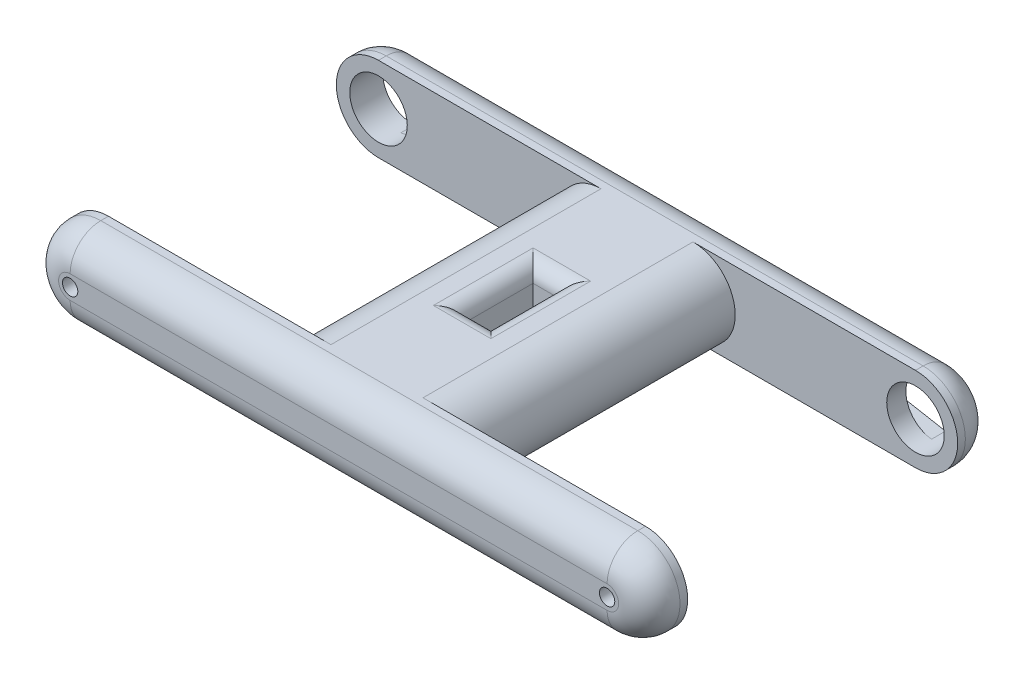
from build123d import *

# Parameters (mm, degrees)
BOSS_EXTRU_1_DEPTH      = 1
BOSS_EXTRU_1_DEPTH_BACK = 4
ESQUISSE1_R             = 3.75
ENL_V_MAT_EXTRU_1_DEPTH = 2.5
BOSS_EXTRU_2_DEPTH      = 35.2
BOSS_EXTRU_3_START      = 5
BOSS_EXTRU_3_DEPTH      = 5
ESQUISSE5_R             = 1
ENL_V_MAT_EXTRU_2_DEPTH = 5
CONG_1_R                = 4
ESQUISSE6_W             = 3.5
ESQUISSE6_H             = 9
ENL_V_MAT_EXTRU_3_DEPTH = 2089.490019804
CONG_2_R                = 2


with BuildPart() as part:
    # Esquisse1 → Boss.-Extru.1 (new, two sides: drawn at the far end of the back side and taken through both)
    with BuildSketch(Plane(origin=(0, 0, 2042.895904074), x_dir=(-1, 0, 0), z_dir=(0, 0, -1)).offset(-BOSS_EXTRU_1_DEPTH_BACK)):
        with BuildLine():
            Line((0, -5.5), (-70, -5.5))
            ThreePointArc((-70, -5.5), (-75.5, 0), (-70, 5.5))
            Line((-70, 5.5), (0, 5.5))
            ThreePointArc((0, 5.5), (5.5, 0), (0, -5.5))
        make_face()
        Circle(ESQUISSE1_R, mode=Mode.SUBTRACT)
        with Locations((-70, 0)):
            Circle(ESQUISSE1_R, mode=Mode.SUBTRACT)
    extrude(amount=BOSS_EXTRU_1_DEPTH + BOSS_EXTRU_1_DEPTH_BACK)

    # Esquisse2 → Enlèv. mat.-Extru.1 (cut)
    with BuildSketch(Plane(origin=(0, 0, 2041.895904074), x_dir=(-1, 0, 0), z_dir=(0, 0, -1))):
        with BuildLine():
            Line((-0.41015625, -3.727502093), (-16.21875, -1.988001116))
            ThreePointArc((-16.21875, -1.988001116), (-18, 0), (-16.21875, 1.988001116))
            Line((-16.21875, 1.988001116), (-0.41015625, 3.727502093))
            Line((-0.41015625, 3.727502093), (-0.41015625, -3.727502093))
        make_face()
        with BuildLine():
            Line((-53.78125, 1.988001116), (-69.58984375, 3.727502093))
            Line((-69.58984375, 3.727502093), (-69.58984375, -3.727502093))
            Line((-69.58984375, -3.727502093), (-53.78125, -1.988001116))
            ThreePointArc((-53.78125, -1.988001116), (-52, 0), (-53.78125, 1.988001116))
        make_face()
    extrude(amount=-ENL_V_MAT_EXTRU_1_DEPTH, mode=Mode.SUBTRACT)

    # Esquisse3 → Boss.-Extru.2 (add)
    with BuildSketch(Plane.XY.offset(2046.895904074)):
        with BuildLine():
            Line((29, 5.5), (41, 5.5))
            ThreePointArc((41, 5.5), (46.5, 0), (41, -5.5))
            Line((41, -5.5), (29, -5.5))
            ThreePointArc((29, -5.5), (23.5, 0), (29, 5.5))
        make_face()
    extrude(amount=BOSS_EXTRU_2_DEPTH)

    # Esquisse4 → Boss.-Extru.3 (add)
    with BuildSketch(Plane.XY.offset(2082.095904074).offset(BOSS_EXTRU_3_START)):
        with BuildLine():
            Line((0, 5.5), (70, 5.5))
            ThreePointArc((70, 5.5), (75.5, 0), (70, -5.5))
            Line((70, -5.5), (0, -5.5))
            ThreePointArc((0, -5.5), (-5.5, 0), (0, 5.5))
        make_face()
    extrude(amount=-BOSS_EXTRU_3_DEPTH)

    # Esquisse5 → Enlèv. mat.-Extru.2 (cut)
    with BuildSketch(Plane.XY.offset(2087.095904074)):
        Circle(ESQUISSE5_R)
        with Locations((70, 0)):
            Circle(ESQUISSE5_R)
    extrude(amount=-ENL_V_MAT_EXTRU_2_DEPTH, mode=Mode.SUBTRACT)

    # Congé1
    # the kernel refuses this fillet: 4 mm, written as the material it takes off along each edge
    with BuildSketch(Plane(origin=(70, 5.5, 2041.895904074), x_dir=(0, 0, 1), z_dir=(-1, 0, 0)), Plane(origin=(0, -5.5, 2041.895904074), x_dir=(0, 0, 1), z_dir=(1, 0, 0)), Plane(origin=(70, -5.5, 2087.095904074), x_dir=(0, 0, -1), z_dir=(-1, 0, 0)), Plane(origin=(0, 5.5, 2087.095904074), x_dir=(0, 0, -1), z_dir=(1, 0, 0))) as cong_1_piece_1:
        with BuildLine():
            CenterArc((CONG_1_R, -CONG_1_R), CONG_1_R, 90, 90)
            Line((0, -CONG_1_R), (0, 0))
            Line((0, 0), (CONG_1_R, 0))
        make_face()
    extrude(amount=70, mode=Mode.SUBTRACT)
    with BuildSketch(Plane(origin=(70, 0, 2087.095904074), x_dir=(0, 1, 0), z_dir=(-1, 0, 0))) as cong_1_piece_2:
        with BuildLine():
            CenterArc((5.5 - CONG_1_R, CONG_1_R), CONG_1_R, 270, 90)
            Line((5.5, CONG_1_R), (5.5, 0))
            Line((5.5, 0), (5.5 - CONG_1_R, 0))
        make_face()
    revolve(axis=Axis((70, 0, 2087.095904074), (0, 0, -1)), revolution_arc=180, mode=Mode.SUBTRACT)
    with BuildSketch(Plane(origin=(0, 0, 2087.095904074), x_dir=(0, -1, 0), z_dir=(1, 0, 0))) as cong_1_piece_3:
        with BuildLine():
            CenterArc((5.5 - CONG_1_R, CONG_1_R), CONG_1_R, 270, 90)
            Line((5.5 - CONG_1_R, 0), (5.5, 0))
            Line((5.5, 0), (5.5, CONG_1_R))
        make_face()
    revolve(axis=Axis((0, 0, 2087.095904074), (0, 0, -1)), revolution_arc=180, mode=Mode.SUBTRACT)
    with BuildSketch(Plane(origin=(0, 0, 2041.895904074), x_dir=(0, 1, 0), z_dir=(1, 0, 0))) as cong_1_piece_4:
        with BuildLine():
            CenterArc((5.5 - CONG_1_R, CONG_1_R), CONG_1_R, 270, 90)
            Line((5.5, CONG_1_R), (5.5, 0))
            Line((5.5, 0), (5.5 - CONG_1_R, 0))
        make_face()
    revolve(axis=Axis((0, 0, 2041.895904074), (0, 0, 1)), revolution_arc=180, mode=Mode.SUBTRACT)
    with BuildSketch(Plane(origin=(70, 0, 2041.895904074), x_dir=(0, -1, 0), z_dir=(-1, 0, 0))) as cong_1_piece_5:
        with BuildLine():
            CenterArc((5.5 - CONG_1_R, CONG_1_R), CONG_1_R, 270, 90)
            Line((5.5 - CONG_1_R, 0), (5.5, 0))
            Line((5.5, 0), (5.5, CONG_1_R))
        make_face()
    revolve(axis=Axis((70, 0, 2041.895904074), (0, 0, 1)), revolution_arc=180, mode=Mode.SUBTRACT)

    # Esquisse6 → Enlèv. mat.-Extru.3 (cut, through all)
    with BuildSketch(Plane(origin=(0, 5.5, 0), x_dir=(1, 0, 0), z_dir=(0, 1, 0))):
        with Locations((35, -2064.495904074)):
            Rectangle(ESQUISSE6_W, ESQUISSE6_H)
    extrude(amount=-ENL_V_MAT_EXTRU_3_DEPTH, mode=Mode.SUBTRACT)

    # Congé2
    cong_2_edges = [part.edges().sort_by_distance(p)[0] for p in [
        (36.75, -5.5, 2064.495904074),
        (35, -5.5, 2068.995904074),
        (33.25, -5.5, 2064.495904074),
        (35, -5.5, 2059.995904074),
        (36.75, 5.5, 2064.495904074),
        (35, 5.5, 2059.995904074),
        (33.25, 5.5, 2064.495904074),
        (35, 5.5, 2068.995904074),
    ]]
    fillet(cong_2_edges, radius=CONG_2_R)


solid = part.part
